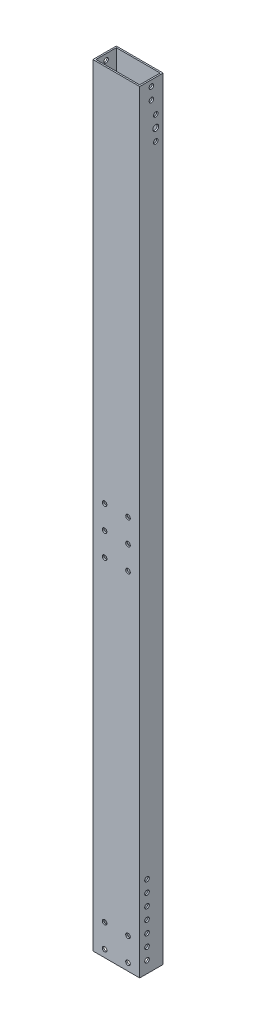
from build123d import *

# Parameters (mm, degrees)
SKETCH1_W               = 50.8
SKETCH1_H               = 838.2
BOSS_EXTRUDE1_DEPTH     = 12.7
SHELL1_T                = -1.5875
CUT_EXTRUDE1_DEPTH      = 421.061019377
CUT_EXTRUDE1_DEPTH_BACK = 421.061019377
SKETCH3_R               = 2.4892
CUT_EXTRUDE2_DEPTH      = 421.061019377
CUT_EXTRUDE2_DEPTH_BACK = 421.061019377
SKETCH4_R               = 3.175
SKETCH4_R_2             = 2.4892
SKETCH5_W               = 31.75
SKETCH5_H               = 26.9875
CUT_EXTRUDE3_DEPTH      = 421.061019377
FILLET1_R               = 3.175
CUT_EXTRUDE4_DEPTH      = 421.061019377
CUT_EXTRUDE4_DEPTH_BACK = 421.061019377
SKETCH6_R               = 2.4892
CUT_EXTRUDE5_DEPTH      = 421.061019377
CUT_EXTRUDE5_DEPTH_BACK = 421.061019377
SKETCH7_R               = 2.4892


with BuildPart() as part:
    # Sketch1 → Boss-Extrude1 (new, symmetric)
    with BuildSketch(Plane.XY):
        Rectangle(SKETCH1_W, SKETCH1_H)
    extrude(amount=BOSS_EXTRUDE1_DEPTH, both=True)

    # Shell1
    shell1_openings = [part.faces().sort_by_distance(p)[0] for p in [
        (0, -419.1, 0),
        (0, 419.1, 0),
    ]]
    offset(amount=SHELL1_T, openings=shell1_openings, kind=Kind.INTERSECTION)

    # Sketch3 → Cut-Extrude1 (cut, two sides: drawn at the far end of the back side and taken through both)
    with BuildSketch(Plane(origin=(0, 0, 0), x_dir=(0, 0, -1), z_dir=(1, 0, 0)).offset(-CUT_EXTRUDE1_DEPTH_BACK)):
        with Locations((0, 400.05)):
            Circle(SKETCH3_R)
        with Locations((0, 412.75)):
            Circle(SKETCH3_R)
    extrude(amount=CUT_EXTRUDE1_DEPTH + CUT_EXTRUDE1_DEPTH_BACK, mode=Mode.SUBTRACT)

    # Sketch4 → Cut-Extrude2 (cut, two sides: drawn at the far end of the back side and taken through both)
    with BuildSketch(Plane(origin=(0, 0, 0), x_dir=(0, 0, -1), z_dir=(1, 0, 0)).offset(-CUT_EXTRUDE2_DEPTH_BACK)):
        with Locations((4.7625, 371.475)):
            Circle(SKETCH4_R)
        with Locations((4.7625, 384.175)):
            Circle(SKETCH4_R_2)
        with Locations((4.7625, 358.775)):
            Circle(SKETCH4_R_2)
    extrude(amount=CUT_EXTRUDE2_DEPTH + CUT_EXTRUDE2_DEPTH_BACK, mode=Mode.SUBTRACT)

    # Sketch5 → Cut-Extrude3 (cut, through all)
    with BuildSketch(Plane.XY):
        with Locations((0, 371.475)):
            Rectangle(SKETCH5_W, SKETCH5_H)
    extrude(amount=-CUT_EXTRUDE3_DEPTH, mode=Mode.SUBTRACT)

    # Fillet1
    fillet1_edges = [part.edges().sort_by_distance(p)[0] for p in [
        (15.875, 384.96875, -11.90625),
        (15.875, 357.98125, -11.90625),
        (-15.875, 357.98125, -11.90625),
        (-15.875, 384.96875, -11.90625),
    ]]
    fillet(fillet1_edges, radius=FILLET1_R)

    # Sketch6 → Cut-Extrude4 (cut, two sides: drawn at the far end of the back side and taken through both)
    with BuildSketch(Plane.XY.offset(-CUT_EXTRUDE4_DEPTH_BACK)):
        with Locations((-12.7, 7.9375)):
            Circle(SKETCH6_R)
        with Locations((12.7, 7.9375)):
            Circle(SKETCH6_R)
        with Locations((12.7, -17.4625)):
            Circle(SKETCH6_R)
        with Locations((12.7, -42.8625)):
            Circle(SKETCH6_R)
        with Locations((-12.7, -17.4625)):
            Circle(SKETCH6_R)
        with Locations((-12.7, -42.8625)):
            Circle(SKETCH6_R)
        with Locations((-12.7, -411.1625)):
            Circle(SKETCH6_R)
        with Locations((12.7, -411.1625)):
            Circle(SKETCH6_R)
        with Locations((12.7, -385.7625)):
            Circle(SKETCH6_R)
        with Locations((-12.7, -385.7625)):
            Circle(SKETCH6_R)
    extrude(amount=CUT_EXTRUDE4_DEPTH + CUT_EXTRUDE4_DEPTH_BACK, mode=Mode.SUBTRACT)

    # Sketch7 → Cut-Extrude5 (cut, two sides: drawn at the far end of the back side and taken through both)
    with BuildSketch(Plane(origin=(0, 0, 0), x_dir=(0, 0, -1), z_dir=(1, 0, 0)).offset(-CUT_EXTRUDE5_DEPTH_BACK)):
        with Locations((-4.7625, -406.4)):
            Circle(SKETCH7_R)
        with Locations((-4.7625, -393.7)):
            Circle(SKETCH7_R)
        with Locations((-4.7625, -381)):
            Circle(SKETCH7_R)
        with Locations((-4.7625, -368.3)):
            Circle(SKETCH7_R)
        with Locations((-4.7625, -355.6)):
            Circle(SKETCH7_R)
        with Locations((-4.7625, -342.9)):
            Circle(SKETCH7_R)
        with Locations((-4.7625, -330.2)):
            Circle(SKETCH7_R)
    extrude(amount=CUT_EXTRUDE5_DEPTH + CUT_EXTRUDE5_DEPTH_BACK, mode=Mode.SUBTRACT)


solid = part.part
